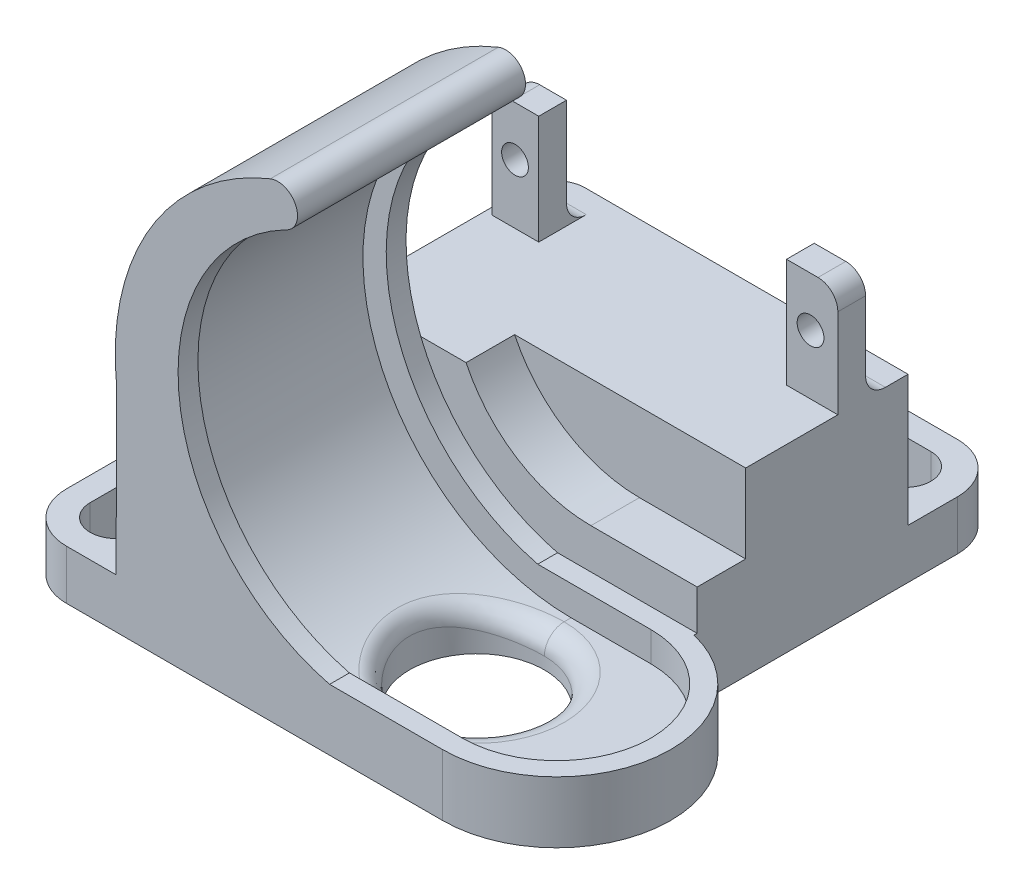
from build123d import *

# Parameters (mm, degrees)
SKETCH1_W                       = 63.5
SKETCH1_H                       = 24.13
BOSS_EXTRUDE1_DEPTH             = 4.064
BOSS_EXTRUDE2_REACH             = 36.207
BOSS_EXTRUDE2_DIRECTION_2_REACH = 36.207
CUT_EXTRUDE1_DEPTH              = 4.064
CUT_EXTRUDE1_DEPTH_BACK         = 66.752974943
SKETCH4_R                       = 8.636
FILLET1_R                       = 2.54
CUT_EXTRUDE2_DEPTH              = 73.348315655
BOSS_EXTRUDE3_DEPTH             = 2.54
BOSS_EXTRUDE4_START             = 2.54
BOSS_EXTRUDE4_DEPTH             = 2.54
BOSS_EXTRUDE5_DEPTH             = 3.81
CUT_EXTRUDE3_DEPTH              = 64.061052508
BOSS_EXTRUDE6_START             = -23.114
SKETCH12_W                      = 44.831
SKETCH12_H                      = 27.027043781
BOSS_EXTRUDE6_DEPTH             = 23.114
BOSS_EXTRUDE7_DEPTH             = 7.874
CUT_EXTRUDE4_START              = -6.219751
CUT_EXTRUDE4_DEPTH              = 6.219751
CUT_EXTRUDE5_DEPTH              = 27.027043781
SKETCH17_W                      = 6.9977
SKETCH17_H                      = 3.556
BOSS_EXTRUDE8_DEPTH             = 13.97
SKETCH18_W                      = 6.389869694
SKETCH18_H                      = 3.556
BOSS_EXTRUDE9_DEPTH             = 13.97
SKETCH19_W                      = 31.75
SKETCH19_H                      = 7.112
CUT_EXTRUDE6_DEPTH              = 13.97
CUT_EXTRUDE7_REACH              = 87.043
SKETCH20_R                      = 1.7145
FILLET2_R                       = 2.54
FILLET3_R                       = 2.54
FILLET4_R                       = 2.54
BOSS_EXTRUDE10_DEPTH            = 29.21
BOSS_EXTRUDE11_DEPTH            = 27.027043781
BOSS_EXTRUDE16_DEPTH            = 6.35
FILLET5_R                       = 6.35
FILLET6_R                       = 3.81


with BuildPart() as part:
    # Sketch1 → Boss-Extrude1 (new body)
    with BuildSketch(Plane(origin=(0, 0, 0), x_dir=(1, 0, 0), z_dir=(0, 1, 0))):
        Rectangle(SKETCH1_W, SKETCH1_H)
    extrude(amount=BOSS_EXTRUDE1_DEPTH)

    # Boss-Extrude2: up to this face of the body (flat: up to its plane)
    boss_extrude2_end = Plane(part.part.faces().sort_by_distance((0, 2.032, 12.065))[0])
    # Sketch2 → Boss-Extrude2 (add, up to the picked face)
    with BuildSketch(Plane.XY, mode=Mode.PRIVATE) as boss_extrude2_sk1:
        with BuildLine():
            Line((0, 4.064), (-26.716755185, 4.064))
            Line((-26.716755185, 4.064), (-31.571041118, 27.367716778))
            ThreePointArc((-31.571041118, 27.367716778), (-27.221246487, 47.076161415), (-11.87173913, 60.180974548))
            ThreePointArc((-11.87173913, 60.180974548), (-8.566242036, 58.774955714), (-9.97226087, 55.46945862))
            ThreePointArc((-9.97226087, 55.46945862), (-26.181898149, 25.654914521), (0, 4.064))
        make_face()
    boss_extrude2_tool1 = split(extrude(boss_extrude2_sk1.sketch, amount=BOSS_EXTRUDE2_REACH, mode=Mode.PRIVATE), bisect_by=boss_extrude2_end, keep=Keep.BOTH, mode=Mode.PRIVATE)
    add(boss_extrude2_tool1.solids().sort_by(Axis((-9.165723, 58.533271, 0), (0, 0, 1)))[0])

    # Boss-Extrude2 direction 2: up to this face of the body (flat: up to its plane)
    boss_extrude2_direction_2_end = Plane(part.part.faces().sort_by_distance((0, 2.032, -12.065))[0])
    # Sketch2 → Boss-Extrude2 direction 2 (add, up to the picked face)
    with BuildSketch(Plane.XY, mode=Mode.PRIVATE) as boss_extrude2_direction_2_sk1:
        with BuildLine():
            Line((0, 4.064), (-26.716755185, 4.064))
            Line((-26.716755185, 4.064), (-31.571041118, 27.367716778))
            ThreePointArc((-31.571041118, 27.367716778), (-27.221246487, 47.076161415), (-11.87173913, 60.180974548))
            ThreePointArc((-11.87173913, 60.180974548), (-8.566242036, 58.774955714), (-9.97226087, 55.46945862))
            ThreePointArc((-9.97226087, 55.46945862), (-26.181898149, 25.654914521), (0, 4.064))
        make_face()
    boss_extrude2_direction_2_tool1 = split(extrude(boss_extrude2_direction_2_sk1.sketch, amount=-BOSS_EXTRUDE2_DIRECTION_2_REACH, mode=Mode.PRIVATE), bisect_by=boss_extrude2_direction_2_end, keep=Keep.BOTH, mode=Mode.PRIVATE)
    add(boss_extrude2_direction_2_tool1.solids().sort_by(Axis((-9.165723, 58.533271, 0), (0, 0, -1)))[0])

    # Sketch4 → Cut-Extrude1 (cut, two sides: drawn at the far end of the back side and taken through both)
    with BuildSketch(Plane(origin=(0, 4.064, 0), x_dir=(1, 0, 0), z_dir=(0, 1, 0)).offset(-CUT_EXTRUDE1_DEPTH_BACK)):
        with Locations(Location((0, 0, 0), (0, 0, 270))):
            Circle(SKETCH4_R)
    extrude(amount=CUT_EXTRUDE1_DEPTH + CUT_EXTRUDE1_DEPTH_BACK, mode=Mode.SUBTRACT)

    # Fillet1
    fillet1_edges = [part.edges().sort_by_distance(p)[0] for p in [
        (-8.636, 5.50091846, 0),
        (8.636, 4.064, 0),
    ]]
    fillet(fillet1_edges, radius=FILLET1_R)

    # Sketch6 → Cut-Extrude2 (cut, through all)
    with BuildSketch(Plane.XY.offset(12.065)):
        Polygon((-31.75, 4.064), (-26.716755185, 4.064), (-25.870202757, 0), (-31.75, 0), align=None)
    extrude(amount=-CUT_EXTRUDE2_DEPTH, mode=Mode.SUBTRACT)

    # Sketch8 → Boss-Extrude3 (add)
    with BuildSketch(Plane.XY.offset(12.065)):
        with BuildLine():
            Line((31.75, 0), (31.75, 7.874))
            Line((31.75, 7.874), (-4.274632474, 7.874))
            ThreePointArc((-4.274632474, 7.874), (-23.508790492, 29.710248048), (-9.97226087, 55.46945862))
            ThreePointArc((-9.97226087, 55.46945862), (-8.566242036, 58.774955714), (-11.87173913, 60.180974548))
            ThreePointArc((-11.87173913, 60.180974548), (-27.221246487, 47.076161415), (-31.571041118, 27.367716778))
            Line((-31.571041118, 27.367716778), (-25.870202757, 0))
            Line((-25.870202757, 0), (31.75, 0))
        make_face()
    extrude(amount=BOSS_EXTRUDE3_DEPTH)

    # Sketch9 → Boss-Extrude4 (add)
    with BuildSketch(Plane(origin=(0, 0, -12.065), x_dir=(-1, 0, 0), z_dir=(0, 0, -1)).offset(BOSS_EXTRUDE4_START)):
        with BuildLine():
            Line((-31.75, 0), (-31.75, 7.874))
            Line((-31.75, 7.874), (4.274632474, 7.874))
            ThreePointArc((4.274632474, 7.874), (23.508790492, 29.710248048), (9.97226087, 55.46945862))
            ThreePointArc((9.97226087, 55.46945862), (8.566242036, 58.774955714), (11.87173913, 60.180974548))
            ThreePointArc((11.87173913, 60.180974548), (27.221246487, 47.076161415), (31.571041118, 27.367716778))
            Line((31.571041118, 27.367716778), (25.870202757, 0))
            Line((25.870202757, 0), (-31.75, 0))
        make_face()
    extrude(amount=-BOSS_EXTRUDE4_DEPTH)

    # Sketch10 → Boss-Extrude5 (add)
    with BuildSketch(Plane(origin=(0, 4.064, 0), x_dir=(1, 0, 0), z_dir=(0, 1, 0))):
        with BuildLine():
            Line((10.218295125, 14.605), (10.218295125, 12.065))
            ThreePointArc((10.218295125, 12.065), (22.283295125, 0), (10.218295125, -12.065))
            Line((10.218295125, -12.065), (10.218295125, -14.605))
            ThreePointArc((10.218295125, -14.605), (24.823295125, 0), (10.218295125, 14.605))
        make_face()
    extrude(amount=BOSS_EXTRUDE5_DEPTH)

    # Sketch11 → Cut-Extrude3 (cut, through all)
    with BuildSketch(Plane(origin=(0, 7.874, 0), x_dir=(1, 0, 0), z_dir=(0, 1, 0))):
        with BuildLine():
            Line((10.218295125, 14.605), (31.75, 14.605))
            Line((31.75, 14.605), (31.75, -14.605))
            Line((31.75, -14.605), (10.218295125, -14.605))
            ThreePointArc((10.218295125, -14.605), (24.823295125, 0), (10.218295125, 14.605))
        make_face()
    extrude(amount=-CUT_EXTRUDE3_DEPTH, mode=Mode.SUBTRACT)

    # Sketch12 → Boss-Extrude6 (add)
    with BuildSketch(Plane.XZ.offset(BOSS_EXTRUDE6_START)):
        with Locations((-8.8011, -28.11852189)):
            Rectangle(SKETCH12_W, SKETCH12_H)
    extrude(amount=BOSS_EXTRUDE6_DEPTH)

    # Sketch13 → Boss-Extrude7 (add)
    with BuildSketch(Plane.XZ):
        Polygon((10.218295125, -14.605), (13.6144, -14.605), (13.6144, -13.335525526), align=None)
    extrude(amount=-BOSS_EXTRUDE7_DEPTH)

    # Sketch14 → Cut-Extrude4 (cut)
    with BuildSketch(Plane.XY.offset(-14.605).offset(CUT_EXTRUDE4_START)):
        with BuildLine():
            Line((0, 13.017313502), (18.620278687, 13.017313502))
            Line((18.620278687, 13.017313502), (17.716686498, 30.734))
            ThreePointArc((17.716686498, 30.734), (-12.527589163, 43.261589163), (0, 13.017313502))
        make_face()
    extrude(amount=CUT_EXTRUDE4_DEPTH, mode=Mode.SUBTRACT)

    # Sketch16 → Cut-Extrude5 (cut)
    with BuildSketch(Plane.XY.offset(-14.605)):
        Polygon((-31.2166, 23.114), (-30.684969694, 23.114), (-25.870202757, 0), (-31.2166, 0), align=None)
    extrude(amount=-CUT_EXTRUDE5_DEPTH, mode=Mode.SUBTRACT)

    # Sketch17 → Boss-Extrude8 (add)
    with BuildSketch(Plane(origin=(0, 23.114, 0), x_dir=(1, 0, 0), z_dir=(0, 1, 0))):
        with Locations((10.11555, 34.413750632)):
            Rectangle(SKETCH17_W, SKETCH17_H)
    extrude(amount=BOSS_EXTRUDE8_DEPTH)

    # Sketch18 → Boss-Extrude9 (add)
    with BuildSketch(Plane(origin=(0, 23.114, 0), x_dir=(1, 0, 0), z_dir=(0, 1, 0))):
        with Locations((-27.490034847, 34.413750632)):
            Rectangle(SKETCH18_W, SKETCH18_H)
    extrude(amount=BOSS_EXTRUDE9_DEPTH)

    # Sketch19 → Cut-Extrude6 (cut)
    with BuildSketch(Plane(origin=(0, 37.084, 0), x_dir=(1, 0, 0), z_dir=(0, 1, 0))):
        with Locations((-8.8392, 36.191750632)):
            Rectangle(SKETCH19_W, SKETCH19_H)
    extrude(amount=-CUT_EXTRUDE6_DEPTH, mode=Mode.SUBTRACT)

    # Sketch20 → Cut-Extrude7 (cut, up to next)
    with BuildSketch(Plane(origin=(0, 0, -36.191750632), x_dir=(-1, 0, 0), z_dir=(0, 0, -1)), mode=Mode.PRIVATE) as cut_extrude7_sk1:
        with Locations((27.75585, 30.734)):
            Circle(SKETCH20_R)
    cut_extrude7_tool1 = extrude(cut_extrude7_sk1.sketch, amount=-CUT_EXTRUDE7_REACH, mode=Mode.PRIVATE) & part.part
    # Sketch20 → Cut-Extrude7 (cut, up to next)
    with BuildSketch(Plane(origin=(0, 0, -36.191750632), x_dir=(-1, 0, 0), z_dir=(0, 0, -1)), mode=Mode.PRIVATE) as cut_extrude7_sk2:
        with Locations((-10.11555, 30.734)):
            Circle(SKETCH20_R)
    cut_extrude7_tool2 = extrude(cut_extrude7_sk2.sketch, amount=-CUT_EXTRUDE7_REACH, mode=Mode.PRIVATE) & part.part
    add(cut_extrude7_tool1.solids().sort_by_distance((-27.75585, 30.734, -36.191751))[0], mode=Mode.SUBTRACT)
    add(cut_extrude7_tool2.solids().sort_by_distance((10.11555, 30.734, -36.191751))[0], mode=Mode.SUBTRACT)

    # Fillet2
    fillet2_edges = [part.edges().sort_by_distance(p)[0] for p in [
        (10.3251, 23.114, -36.191750632),
    ]]
    fillet(fillet2_edges, radius=FILLET2_R)

    # Fillet3
    fillet3_edges = [part.edges().sort_by_distance(p)[0] for p in [
        (-27.699584847, 23.114, -36.191750632),
    ]]
    fillet(fillet3_edges, radius=FILLET3_R)

    # Fillet4
    fillet4_edges = [part.edges().sort_by_distance(p)[0] for p in [
        (13.6144, 37.084, -34.413750632),
        (-30.684969694, 37.084, -34.413750632),
    ]]
    fillet(fillet4_edges, radius=FILLET4_R)

    # Sketch26 → Boss-Extrude10 (add)
    with BuildSketch(Plane.XY.offset(14.605)):
        Polygon((-25.870202757, 0), (-31.653563464, 0), (-31.571041118, 27.367716778), align=None)
    extrude(amount=-BOSS_EXTRUDE10_DEPTH)

    # Sketch22 → Boss-Extrude11 (add)
    with BuildSketch(Plane(origin=(0, 0, -14.605), x_dir=(-1, 0, 0), z_dir=(0, 0, -1))):
        Polygon((30.684969694, 23.114), (31.583867423, 23.114), (31.653563464, 0), (25.870202757, 0), align=None)
    extrude(amount=BOSS_EXTRUDE11_DEPTH)

    # Sketch23 → Boss-Extrude16 (add)
    with BuildSketch(Plane.XZ):
        with BuildLine():
            Line((-15.554631727, 14.605), (-44.353563464, 14.605))
            Line((-44.353563464, 14.605), (-44.353563464, -41.632043781))
            ThreePointArc((-44.353563464, -41.632043781), (-40.609144413, -50.636907459), (-31.583867423, -54.331852538))
            Line((-31.583867423, -54.331852538), (13.6144, -54.332043781))
            Line((13.6144, -54.332043781), (13.6144, -35.10352189))
            Line((13.6144, -35.10352189), (-15.554631727, -35.10352189))
            Line((-15.554631727, -35.10352189), (-15.554631727, 14.605))
        make_face()
        with BuildLine():
            Line((-34.701563464, 8.255), (-34.701563464, -42.545))
            ThreePointArc((-34.701563464, -42.545), (-38.003563464, -45.847), (-41.305563464, -42.545))
            Line((-41.305563464, -42.545), (-41.305563464, 8.255))
            ThreePointArc((-41.305563464, 8.255), (-38.003563464, 11.557), (-34.701563464, 8.255))
        make_face(mode=Mode.SUBTRACT)
        with BuildLine():
            Line((-24.859733712, -44.680043781), (6.890266288, -44.680043781))
            ThreePointArc((6.890266288, -44.680043781), (10.192266288, -47.982043781), (6.890266288, -51.284043781))
            Line((6.890266288, -51.284043781), (-24.859733712, -51.284043781))
            ThreePointArc((-24.859733712, -51.284043781), (-28.161733712, -47.982043781), (-24.859733712, -44.680043781))
        make_face(mode=Mode.SUBTRACT)
    extrude(amount=-BOSS_EXTRUDE16_DEPTH)

    # Fillet5
    fillet5_edges = [part.edges().sort_by_distance(p)[0] for p in [
        (13.6144, 3.175, -54.332043781),
        (-44.353563464, 3.175, 14.605),
    ]]
    fillet(fillet5_edges, radius=FILLET5_R)

    # Fillet6
    fillet6_edges = [part.edges().sort_by_distance(p)[0] for p in [
        (-31.609141812, 14.732, -41.632043781),
    ]]
    fillet(fillet6_edges, radius=FILLET6_R)


solid = part.part
